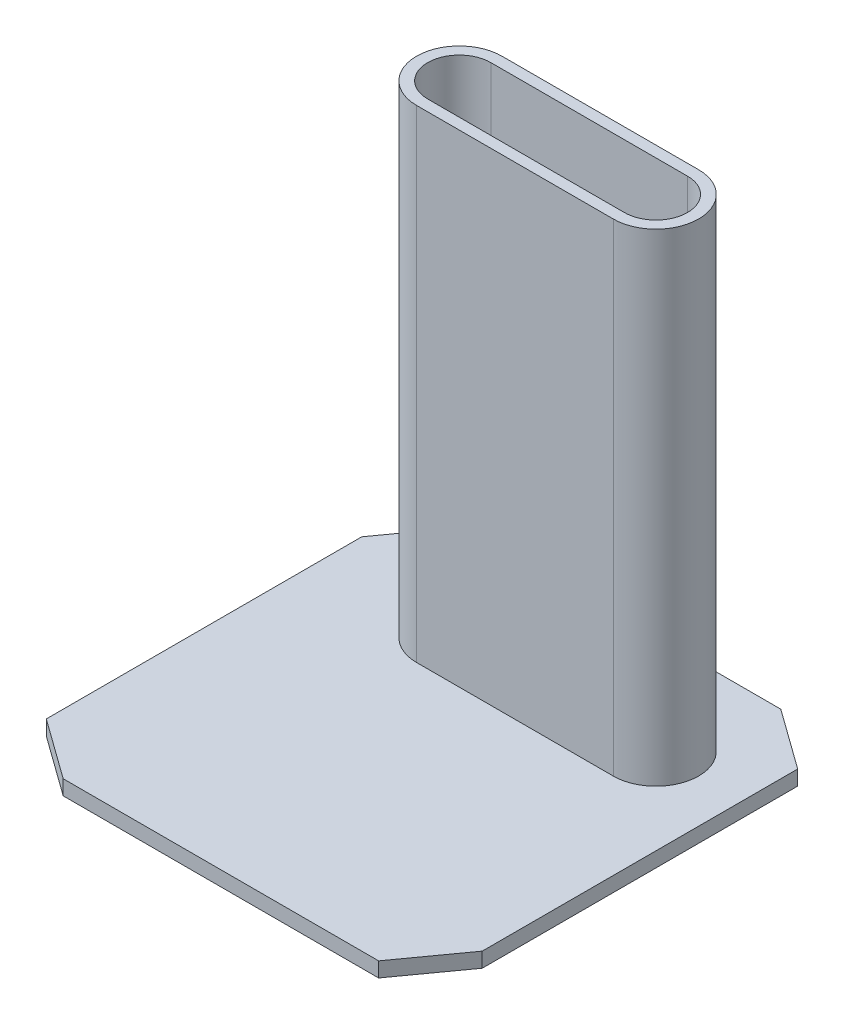
from build123d import *

# Parameters (mm, degrees)
BOSS_EXTRUDE1_DEPTH = 4
BOSS_EXTRUDE3_DEPTH = 130
CUT_EXTRUDE1_DEPTH  = 130


with BuildPart() as part:
    # Sketch1 → Boss-Extrude1 (new body)
    with BuildSketch(Plane(origin=(0, 0, 0), x_dir=(1, 0, 0), z_dir=(0, 1, 0))):
        Polygon((-73.489063378, -86.234473132), (11.510936622, -86.234473132), (23.193096829, -70.000954324), (23.193096829, 14.999045676), (6.959578021, 26.681205883), (-78.040421979, 26.681205883), (-89.722582186, 10.447687075), (-89.722582186, -74.552312925), align=None)
    extrude(amount=BOSS_EXTRUDE1_DEPTH)

    # Sketch2 → Boss-Extrude3 (add)
    with BuildSketch(Plane(origin=(0, 4, 0), x_dir=(1, 0, 0), z_dir=(0, 1, 0))):
        with BuildLine():
            Line((-53, 11.5), (0, 11.5))
            ThreePointArc((0, 11.5), (11.5, 0), (0, -11.5))
            Line((0, -11.5), (-53, -11.5))
            ThreePointArc((-53, -11.5), (-64.5, 0), (-53, 11.5))
        make_face()
    extrude(amount=BOSS_EXTRUDE3_DEPTH)

    # Sketch3 → Cut-Extrude1 (cut)
    with BuildSketch(Plane(origin=(0, 134, 0), x_dir=(1, 0, 0), z_dir=(0, 1, 0))):
        with BuildLine():
            Line((-53, -8.5), (0, -8.5))
            ThreePointArc((0, -8.5), (8.5, 0), (0, 8.5))
            Line((0, 8.5), (-53, 8.5))
            ThreePointArc((-53, 8.5), (-61.5, 0), (-53, -8.5))
        make_face()
    extrude(amount=-CUT_EXTRUDE1_DEPTH, mode=Mode.SUBTRACT)


solid = part.part
